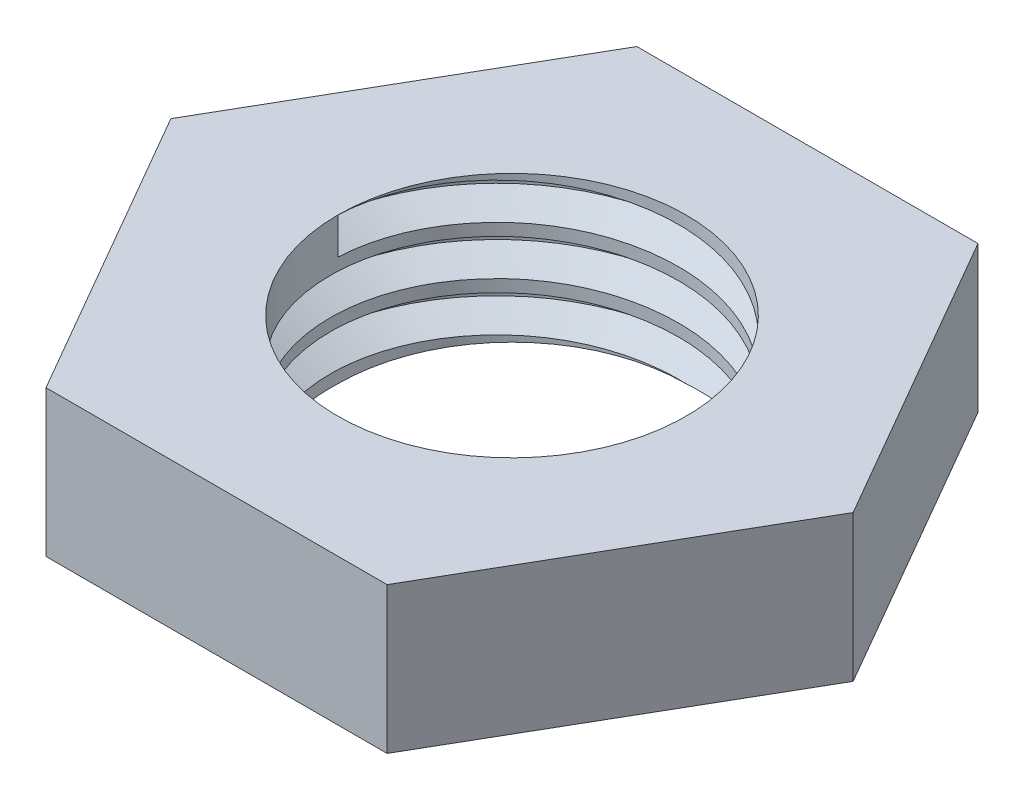
from build123d import *

# Parameters (mm, degrees)
SKETCH1_R           = 3.575
BOSS_EXTRUDE1_DEPTH = 3
THREAD1_PITCH       = 1


with BuildPart() as part:
    # Sketch1 → Boss-Extrude1 (new body)
    with BuildSketch(Plane(origin=(0, 0, 0), x_dir=(1, 0, 0), z_dir=(0, 1, 0))):
        Polygon((7, 0), (3.5, 6.062177826), (-3.5, 6.062177826), (-7, 0), (-3.5, -6.062177826), (3.5, -6.062177826), align=None)
        with Locations(Location((0, 0, 0), (0, 0, 270))):
            Circle(SKETCH1_R, mode=Mode.SUBTRACT)
    extrude(amount=BOSS_EXTRUDE1_DEPTH)

    # Thread1: the profile of Thread Profile1 profile screwed along a right-hand helix of 3 turns, 8 arcs to a turn; built about Z, then put on its axis
    thread1_z = Axis((0, 0, 0), (0, 0, 1))
    thread1_corners = [(3.5747, 0, -0.000173205), (4.116265875, 0, 0.312499999), (4.116265875, 0, 0.437499999), (3.5747, 0, 0.750173202)]
    with BuildLine(mode=Mode.PRIVATE) as thread1_profile:
        Line(thread1_corners[0], thread1_corners[1])
        Line(thread1_corners[1], thread1_corners[2])
        Line(thread1_corners[2], thread1_corners[3])
        Line(thread1_corners[3], thread1_corners[0])
    thread1_cap = Face(thread1_profile.wire())
    thread1_turn_angles = [0, 22.5, 45, 67.5, 90, 112.5, 135, 157.5, 180, 202.5, 225, 247.5, 270, 292.5, 315, 337.5, 360]
    thread1_turn_weights = [1, 0.9238795325112867, 1, 0.9238795325112867, 1, 0.9238795325112867, 1, 0.9238795325112867, 1, 0.9238795325112867, 1, 0.9238795325112867, 1, 0.9238795325112867, 1, 0.9238795325112867, 1]
    thread1_turn_rails = [Edge.make_bspline([Vector(p[0], p[1], 0).rotate(thread1_z, thread1_turn_angles[k]) / thread1_turn_weights[k] + Vector(0, 0, p[2] + THREAD1_PITCH * thread1_turn_angles[k] / 360) for k in range(17)], [0, 0, 0, 1, 1, 2, 2, 3, 3, 4, 4, 5, 5, 6, 6, 7, 7, 8, 8, 8], 2, thread1_turn_weights) for p in thread1_corners]
    thread1_turn_sides = [Face.make_surface_from_curves(thread1_turn_rails[p[0]], thread1_turn_rails[p[1]]) for p in [(0, 1), (1, 2), (2, 3), (3, 0)]]
    thread1 = Plane(origin=(0, 3, 0), x_dir=(-1, 0, 0), z_dir=(0, -1, 0)) * Solid(Shell([*[p.moved(Location((0, 0, THREAD1_PITCH * i))) for i in range(3) for p in thread1_turn_sides], thread1_cap, thread1_cap.rotate(thread1_z, 1080).moved(Location((0, 0, THREAD1_PITCH * 1080 / 360)))]))
    add(thread1, mode=Mode.SUBTRACT)


solid = part.part
